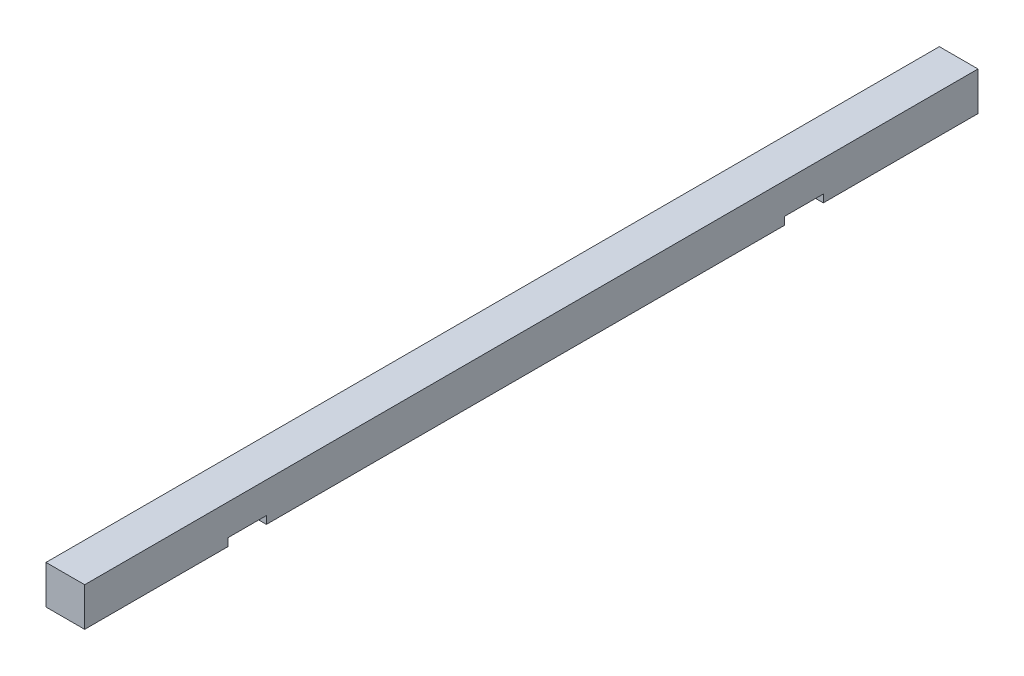
from build123d import *

# Parameters (mm, degrees)
ESQUISSE1_W             = 10
ESQUISSE1_H             = 10
BOSS_EXTRU_1_DEPTH      = 231
ESQUISSE2_W             = 10
ESQUISSE2_H             = 10
ENL_V_MAT_EXTRU_1_DEPTH = 2
ESQUISSE3_W             = 10
ESQUISSE3_H             = 10
ENL_V_MAT_EXTRU_2_DEPTH = 2


with BuildPart() as part:
    # Esquisse1 → Boss.-Extru.1 (new body)
    with BuildSketch(Plane.XY):
        with Locations((5, 5)):
            Rectangle(ESQUISSE1_W, ESQUISSE1_H)
    extrude(amount=BOSS_EXTRU_1_DEPTH)

    # Esquisse2 → Enlèv. mat.-Extru.1 (cut)
    with BuildSketch(Plane.XZ):
        with Locations((5, 189)):
            Rectangle(ESQUISSE2_W, ESQUISSE2_H)
    extrude(amount=-ENL_V_MAT_EXTRU_1_DEPTH, mode=Mode.SUBTRACT)

    # Esquisse3 → Enlèv. mat.-Extru.2 (cut)
    with BuildSketch(Plane.XZ):
        with Locations((5, 45)):
            Rectangle(ESQUISSE3_W, ESQUISSE3_H)
    extrude(amount=-ENL_V_MAT_EXTRU_2_DEPTH, mode=Mode.SUBTRACT)


solid = part.part
